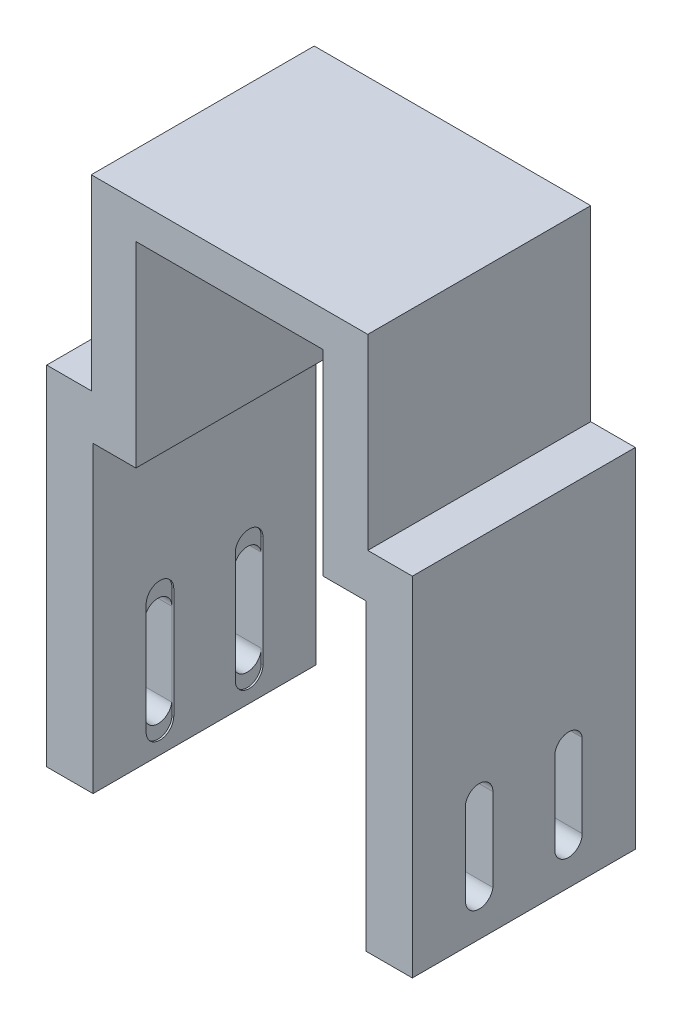
from build123d import *

# Parameters (mm, degrees)
BOSS_EXTRUDE1_DEPTH     = 25
CUT_EXTRUDE1_DEPTH      = 64.272492191
CUT_EXTRUDE1_DEPTH_BACK = 64.272492191
SKETCH5_W               = 5
SKETCH5_H               = 39.019266937
BOSS_EXTRUDE2_DEPTH     = 25
CUT_EXTRUDE2_DEPTH      = 65.679272322
CUT_EXTRUDE2_DEPTH_BACK = 65.679272322
SKETCH6_W               = 4.8
SKETCH6_H               = 34.019266937
CUT_EXTRUDE3_DEPTH      = 65.679272322
CUT_EXTRUDE3_DEPTH_BACK = 65.679272322


with BuildPart() as part:
    # Sketch1 → Boss-Extrude1 (new body)
    with BuildSketch(Plane.XY):
        Polygon((10.5, 0), (10.5, -56.019266937), (15.5, -56.019266937), (15.5, 3.980733063), (-15.5, 3.980733063), (-15.5, -56.019266937), (-10.5, -56.019266937), (-10.5, 0), align=None)
    extrude(amount=BOSS_EXTRUDE1_DEPTH)

    # Sketch3 → Cut-Extrude1 (cut, two sides: drawn at the far end of the back side and taken through both)
    with BuildSketch(Plane(origin=(0, 0, 0), x_dir=(0, 0, -1), z_dir=(1, 0, 0)).offset(-CUT_EXTRUDE1_DEPTH_BACK)):
        with BuildLine():
            ThreePointArc((-5.95, -40.619994267), (-7.5, -39.069994267), (-9.05, -40.619994267))
            Line((-9.05, -40.619994267), (-9.05, -53.019266937))
            ThreePointArc((-9.05, -53.019266937), (-7.5, -54.569266937), (-5.95, -53.019266937))
            Line((-5.95, -53.019266937), (-5.95, -40.619994267))
        make_face()
        with BuildLine():
            Line((-15.95, -53.019266937), (-15.95, -40.619994267))
            ThreePointArc((-15.95, -40.619994267), (-17.5, -39.069994267), (-19.05, -40.619994267))
            Line((-19.05, -40.619994267), (-19.05, -53.019266937))
            ThreePointArc((-19.05, -53.019266937), (-17.5, -54.569266937), (-15.95, -53.019266937))
        make_face()
    extrude(amount=CUT_EXTRUDE1_DEPTH + CUT_EXTRUDE1_DEPTH_BACK, mode=Mode.SUBTRACT)

    # Sketch5 → Boss-Extrude2 (add)
    with BuildSketch(Plane.XY):
        with Locations((-18, -36.509633468)):
            Rectangle(SKETCH5_W, SKETCH5_H)
        with Locations((18, -36.509633468)):
            Rectangle(SKETCH5_W, SKETCH5_H)
    extrude(amount=BOSS_EXTRUDE2_DEPTH)

    # Sketch6 → Cut-Extrude2 (cut, two sides: drawn at the far end of the back side and taken through both)
    with BuildSketch(Plane.XY.offset(-CUT_EXTRUDE2_DEPTH_BACK)):
        with Locations((12.9, -39.009633468)):
            Rectangle(SKETCH6_W, SKETCH6_H)
        with Locations((-12.9, -39.009633468)):
            Rectangle(SKETCH6_W, SKETCH6_H)
    extrude(amount=CUT_EXTRUDE2_DEPTH + CUT_EXTRUDE2_DEPTH_BACK, mode=Mode.SUBTRACT)

    # Sketch7 → Cut-Extrude3 (cut, two sides: drawn at the far end of the back side and taken through both)
    with BuildSketch(Plane(origin=(0, 0, 0), x_dir=(0, 0, -1), z_dir=(1, 0, 0)).offset(-CUT_EXTRUDE3_DEPTH_BACK)):
        with BuildLine():
            ThreePointArc((-5.95, -42.199569632), (-7.599621494, -40.888164442), (-9.032213316, -42.433711374))
            Line((-9.032213316, -42.433711374), (-9.032213316, -51.753408679))
            ThreePointArc((-9.032213316, -51.753408679), (-7.382591821, -53.064813869), (-5.95, -51.519266937))
            Line((-5.95, -51.519266937), (-5.95, -42.199569632))
        make_face()
        with BuildLine():
            ThreePointArc((-15.967786684, -42.433711374), (-17.400378506, -40.888164442), (-19.05, -42.199569632))
            Line((-19.05, -42.199569632), (-19.05, -51.519266937))
            ThreePointArc((-19.05, -51.519266937), (-17.617408179, -53.064813869), (-15.967786684, -51.753408679))
            Line((-15.967786684, -51.753408679), (-15.967786684, -42.433711374))
        make_face()
    extrude(amount=CUT_EXTRUDE3_DEPTH + CUT_EXTRUDE3_DEPTH_BACK, mode=Mode.SUBTRACT)


solid = part.part
